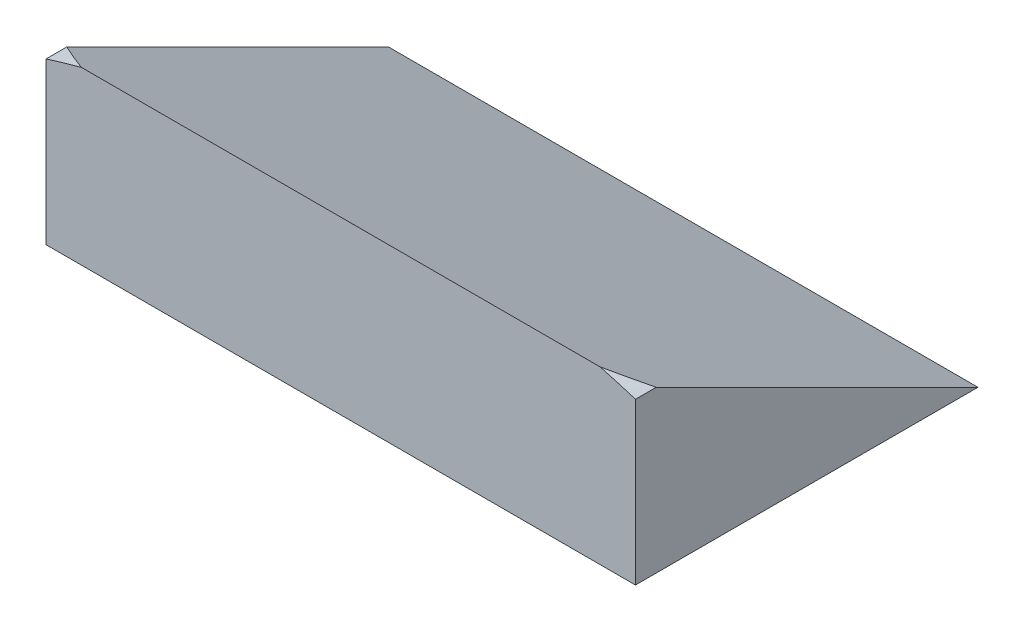
from build123d import *

# Parameters (mm, degrees)
BOSS_EXTRUDE2_DEPTH      = 200
CUT_EXTRUDE10_DEPTH      = 267.469979715
CUT_EXTRUDE10_DEPTH_BACK = 267.469979715


with BuildPart() as part:
    # Sketch18 → Boss-Extrude2 (new body)
    with BuildSketch(Plane.XY):
        with BuildLine():
            Line((137.5, 90.157498667), (137.5, 15.1))
            Line((137.5, 15.1), (-137.5, 15.1))
            Line((-137.5, 15.1), (-137.5, 90.157498667))
            add(Edge.make_bspline(
                [(137.5, 90.157498667), (0, 134.209579667), (-137.5, 90.157498667)],
                knots=[4.102328945, 4.102328945, 4.102328945, 5.322449015, 5.322449015, 5.322449015], degree=2, weights=[1, 0.819613624, 1]))
        make_face()
    extrude(amount=-BOSS_EXTRUDE2_DEPTH)

    # Sketch15 → Cut-Extrude10 (cut, two sides: drawn at the far end of the back side and taken through both)
    with BuildSketch(Plane(origin=(0, 0, 0), x_dir=(0, 0, -1), z_dir=(1, 0, 0)).offset(-CUT_EXTRUDE10_DEPTH_BACK)):
        Polygon((0, 110), (0, 95), (200, -5), (200, 110), align=None)
    extrude(amount=CUT_EXTRUDE10_DEPTH + CUT_EXTRUDE10_DEPTH_BACK, mode=Mode.SUBTRACT)


solid = part.part
